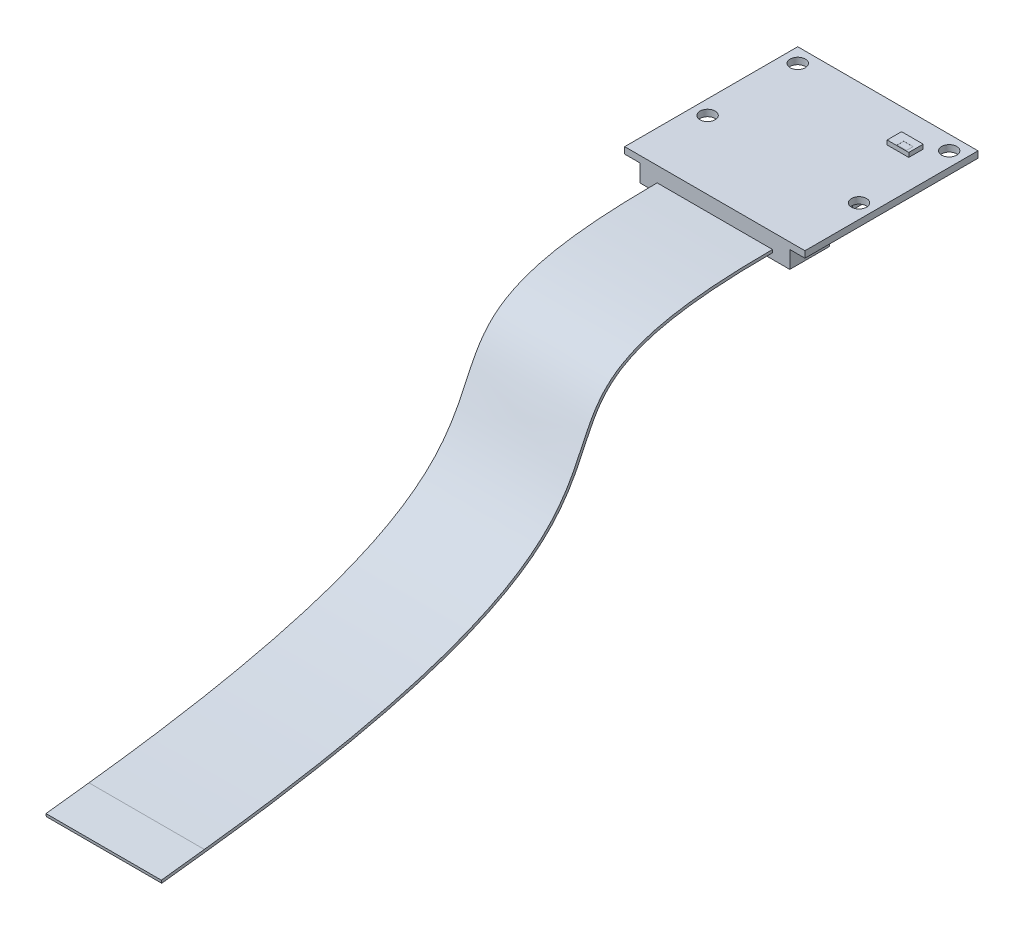
from build123d import *

# Parameters (mm, degrees)
SKIZZE1_W                                 = 25
SKIZZE1_H                                 = 24
PCB_DEPTH                                 = 0.9
SKIZZE2_R                                 = 1.05
MOUNTING_HOLES_DEPTH                      = 20.165333287
SKIZZE3_W                                 = 20.8
SKIZZE3_H                                 = 5.5
CONNECTOR_CLOSED_DEPTH                    = 2.4
SKIZZE4_W                                 = 17.7
SKIZZE4_H                                 = 11.6
COMPONENTS_WORST_CASE_BOUNDARY_BOX_DEPTH  = 1.3
CABLE_156MM_FREE_LENGTH_START             = -8
CABLE_156MM_FREE_LENGTH_DEPTH             = 16
SKIZZE7_W                                 = 3
SKIZZE7_H                                 = 2
COMPONENTS_WORST_CASE_BOUNDARY_BOX2_DEPTH = 0.6
SKIZZE8_W                                 = 1.3
SKIZZE8_H                                 = 0.9
STATUS_LED_DEPTH                          = 0.01


# Read off the part's stored shape, not the designer's step: Cable_156mm_free_Length
with BuildPart() as part:
    # Skizze1 → PCB (new body)
    with BuildSketch(Plane(origin=(0, 0, 0), x_dir=(1, 0, 0), z_dir=(0, 1, 0))):
        with Locations((0, 2.5)):
            Rectangle(SKIZZE1_W, SKIZZE1_H)
    extrude(amount=-PCB_DEPTH)

    # Skizze2 → Mounting_Holes (cut, through all)
    with BuildSketch(Plane(origin=(0, 0, 0), x_dir=(1, 0, 0), z_dir=(0, 1, 0))):
        with Locations(Location((10.5, 12.5, 0), (0, 0, 270))):
            Circle(SKIZZE2_R)
        with Locations(Location((10.5, 0, 0), (0, 0, 270))):
            Circle(SKIZZE2_R)
        with Locations(Location((-10.5, 0, 0), (0, 0, 90))):
            Circle(SKIZZE2_R)
        with Locations(Location((-10.5, 12.5, 0), (0, 0, 90))):
            Circle(SKIZZE2_R)
    extrude(amount=-MOUNTING_HOLES_DEPTH, mode=Mode.SUBTRACT)

    # Skizze3 → Connector_closed (add)
    with BuildSketch(Plane.XZ.offset(0.9)):
        with Locations((0, 6.75)):
            Rectangle(SKIZZE3_W, SKIZZE3_H)
    extrude(amount=CONNECTOR_CLOSED_DEPTH)

    # Skizze4 → Components_worst-case_Boundary-Box (add)
    with BuildSketch(Plane.XZ.offset(0.9)):
        with Locations((-0.15, -6.7)):
            Rectangle(SKIZZE4_W, SKIZZE4_H)
    extrude(amount=COMPONENTS_WORST_CASE_BOUNDARY_BOX_DEPTH)

    # Cable_156mm_free_Length outline → Cable_156mm_free_Length (add)
    with BuildSketch(Plane.YZ.offset(CABLE_156MM_FREE_LENGTH_START)):
        with BuildLine():
            Line((-2.5, 9.5), (-2.1, 9.5))
            add(Edge.make_bspline(
                [(-2.1, 9.5), (-2.1, 11.923148478), (-2.215201737, 16.278283672), (-2.706262662, 21.50857729), (-3.488235009, 25.607537846), (-4.533771886, 28.746241452), (-6.456403653, 32.270525602), (-9.750960267, 34.806204592), (-13.748034401, 36.389811343), (-16.935197705, 38.200365464), (-19.104762614, 39.815753488), (-21.291770003, 42.010569567), (-23.468872976, 44.955889812), (-26.084247232, 49.682101563), (-29.050732723, 57.371999812), (-32.167555148, 70.072135004), (-33.957002471, 81.618354938), (-34.75851656, 88.293333863)],
                knots=[0, 0, 0, 0, 0.05, 0.1, 0.15, 0.2, 0.25, 0.375, 0.5, 0.55, 0.6, 0.65, 0.7, 0.75, 0.833333333, 0.916666667, 1, 1, 1, 1], degree=3))
            Line((-34.75851656, 88.293333863), (-35.473842402, 94.250540335))
            Line((-35.473842402, 94.250540335), (-35.8709895, 94.202851945))
            Line((-35.8709895, 94.202851945), (-35.155663658, 88.245645474))
            add(Edge.make_bspline(
                [(-2.5, 9.5), (-2.49991999, 11.916217895), (-2.614961707, 16.257491924), (-3.103409781, 21.456511634), (-3.877849534, 25.512104759), (-4.905133502, 28.592480644), (-6.772453078, 32.007676926), (-9.917324686, 34.433805752), (-13.910554712, 36.023692794), (-17.153513758, 37.863702796), (-19.368546351, 39.513102878), (-21.598308056, 41.75128144), (-23.808470268, 44.742371291), (-26.451587049, 49.520178635), (-29.435343479, 57.258684303), (-32.561217345, 69.998547346), (-34.352987935, 81.56203346), (-35.155663658, 88.245645474)],
                knots=[0, 0, 0, 0, 0.05, 0.1, 0.15, 0.2, 0.25, 0.375, 0.5, 0.55, 0.6, 0.65, 0.7, 0.75, 0.833333333, 0.916666667, 1, 1, 1, 1], degree=3))
        make_face()
    extrude(amount=CABLE_156MM_FREE_LENGTH_DEPTH)

    # Skizze7 → Components_worst-case_Boundary-Box2 (add)
    with BuildSketch(Plane(origin=(0, 0, 0), x_dir=(1, 0, 0), z_dir=(0, 1, 0))):
        with Locations((7, 9.9)):
            Rectangle(SKIZZE7_W, SKIZZE7_H)
    extrude(amount=COMPONENTS_WORST_CASE_BOUNDARY_BOX2_DEPTH)

    # Skizze8 → Status_LED (cut)
    with BuildSketch(Plane(origin=(0, 0.6, 0), x_dir=(1, 0, 0), z_dir=(0, 1, 0))):
        with Locations((7.45, 9.45)):
            Rectangle(SKIZZE8_W, SKIZZE8_H)
    extrude(amount=-STATUS_LED_DEPTH, mode=Mode.SUBTRACT)


solid = part.part
